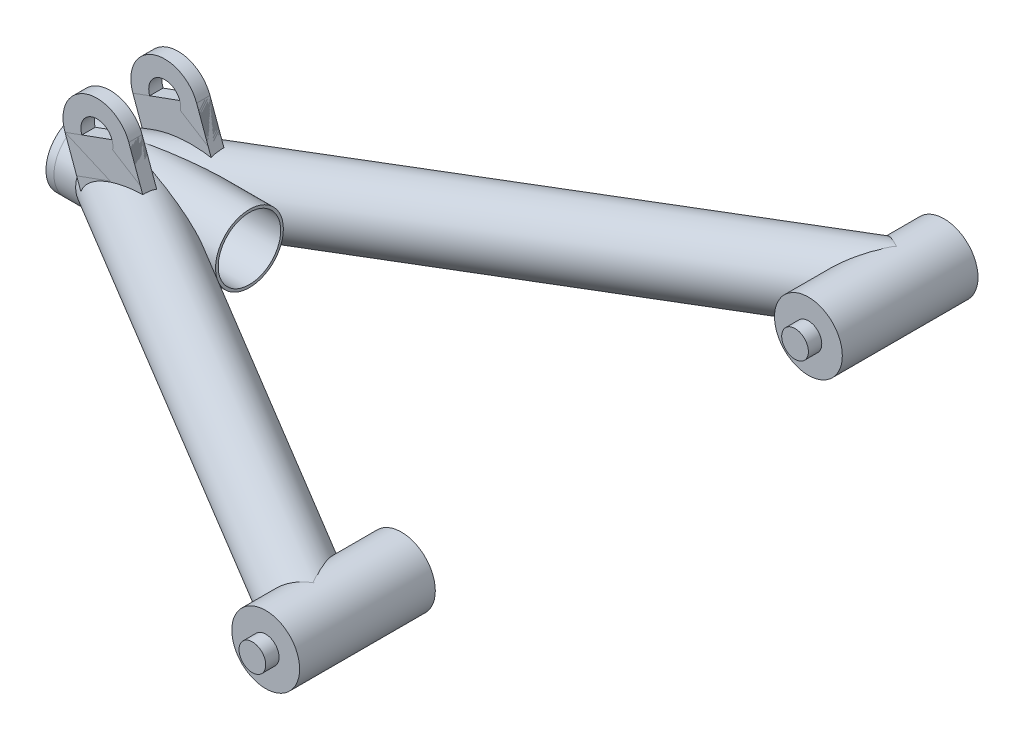
from build123d import *

# Parameters (mm, degrees)
ONEINCH_START                               = 87.83326389
ONEINCH_PIPE_ONE_INCH_1_OUTLINE_R           = 12.7
ONEINCH_PIPE_ONE_INCH_1_OUTLINE_R_2         = 11.7
ONEINCH_PIPE_ONE_INCH_1_DEPTH               = 143.870277309
ONEINCH_START_2                             = 41.95848565
ONEINCH_PIPE_ONE_INCH_1_2_OUTLINE_R         = 12.7
ONEINCH_PIPE_ONE_INCH_1_2_OUTLINE_R_2       = 11.7
ONEINCH_PIPE_ONE_INCH_1_2_DEPTH             = 212.168707844
ONEINCH_START_3                             = -3.509192285
ONEINCH_PIPE_ONE_INCH_1_3_DEPTH             = 14.401092481
ONEINCH_START_4                             = -120.003337429
ONEINCH_PIPE_ONE_INCH_1_4_DEPTH             = 116.494145144
ONEINCH_START_5                             = 42.39257022
ONEINCH_PIPE_ONE_INCH_1_5_DEPTH             = 194.510357761
ONEINCH_PIPE_ONE_INCH_1_6_OUTLINE_R         = 12.7
ONEINCH_PIPE_ONE_INCH_1_6_OUTLINE_R_2       = 11.7
ONEINCH_PIPE_ONE_INCH_1_6_DEPTH             = 143.870277309
ONEINCH_PIPE_ONE_INCH_1_7_OUTLINE_R         = 12.7
ONEINCH_PIPE_ONE_INCH_1_7_OUTLINE_R_2       = 11.7
ONEINCH_PIPE_ONE_INCH_1_7_DEPTH             = 212.168707844
ONEINCH_START_6                             = -10.891900196
ONEINCH_PIPE_ONE_INCH_1_8_DEPTH             = 14.401092481
ONEINCH_START_7                             = 3.509192285
ONEINCH_PIPE_ONE_INCH_1_9_DEPTH             = 116.494145144
ONEINCH_PIPE_ONE_INCH_1_10_DEPTH            = 194.510357761
ONEINCH_START_8                             = 37.29
ONEINCH_PIPE_ONE_INCH_1_11_OUTLINE_R        = 12.7
ONEINCH_PIPE_ONE_INCH_1_11_OUTLINE_R_2      = 11.7
ONEINCH_PIPE_ONE_INCH_1_11_DEPTH            = 60.5
ONEINCH_START_9                             = 76.2
ONEINCH_PIPE_ONE_INCH_1_12_OUTLINE_R        = 12.7
ONEINCH_PIPE_ONE_INCH_1_12_OUTLINE_R_2      = 11.7
ONEINCH_PIPE_ONE_INCH_1_12_DEPTH            = 50.8
ONEINCH_START_10                            = -127
ONEINCH_PIPE_ONE_INCH_1_13_OUTLINE_R        = 12.7
ONEINCH_PIPE_ONE_INCH_1_13_OUTLINE_R_2      = 11.7
ONEINCH_PIPE_ONE_INCH_1_13_DEPTH            = 50.8
SKETCH16_R                                  = 12.7
SKETCH16_R_2                                = 6
WASHERS_ONEINCHDIA12MM_1_DEPTH              = 3
SKETCH110_R                                 = 6
SUSPENSIONMOUNT_12MMHOLE1INCHWIDE_1_DEPTH   = 5
SKETCH110_ON_SEGMENT_2_R                    = 6
SUSPENSIONMOUNT_12MMHOLE1INCHWIDE_1_2_DEPTH = 5
SKETCH112_W                                 = 25.4
SKETCH112_H                                 = 5
ONEINCH_ONE_INCH_5MM_PLATE_3_DEPTH          = 24.072735663
SKETCH112_ON_SEGMENT_2_W                    = 25.4
SKETCH112_ON_SEGMENT_2_H                    = 5
ONEINCH_ONE_INCH_5MM_PLATE_3_2_DEPTH        = 21.307396636
SKETCH114_R                                 = 12.7
SKETCH114_R_2                               = 5
SUSPENSIONMOUNT_BUSHING10MM_1_DEPTH         = 50.8
SKETCH114_ON_SEGMENT_2_R                    = 12.7
SKETCH114_ON_SEGMENT_2_R_2                  = 5
SUSPENSIONMOUNT_BUSHING10MM_1_2_DEPTH       = 50.8
BOSS_EXTRUDE1_DEPTH                         = 5
BOSS_EXTRUDE1_DEPTH_BACK                    = 55.8
SKETCH115_R                                 = 5
BOSS_EXTRUDE2_DEPTH                         = 5
BOSS_EXTRUDE2_DEPTH_BACK                    = 55.8
SKETCH116_R                                 = 5


with BuildPart() as part:
    # Oneinch PIPE_ONE_INCH(1): read off the stored shape, not the designer's step
    # Oneinch PIPE_ONE_INCH(1) outline → Oneinch PIPE_ONE_INCH(1) (new body)
    with BuildSketch(Plane(origin=(0, 0, 0), x_dir=(0.5142673415114335, 0, 0.8576299326951937), z_dir=(0.8576299326951937, 0, -0.5142673415114338)).offset(ONEINCH_START)):
        with Locations((25.159894842, 0)):
            Circle(ONEINCH_PIPE_ONE_INCH_1_OUTLINE_R)
        with Locations((25.159894842, 0)):
            Circle(ONEINCH_PIPE_ONE_INCH_1_OUTLINE_R_2, mode=Mode.SUBTRACT)
    extrude(amount=ONEINCH_PIPE_ONE_INCH_1_DEPTH)

    # Oneinch PIPE_ONE_INCH_1 2 outline → Oneinch PIPE_ONE_INCH_1 2 (add)
    with BuildSketch(Plane(origin=(0, 0, 0), x_dir=(0.5142673415114335, 0, 0.8576299326951937), z_dir=(0.8576299326951937, 0, -0.5142673415114338)).offset(ONEINCH_START_2)):
        with Locations((25.159894842, 0)):
            Circle(ONEINCH_PIPE_ONE_INCH_1_2_OUTLINE_R)
        with Locations((25.159894842, 0)):
            Circle(ONEINCH_PIPE_ONE_INCH_1_2_OUTLINE_R_2, mode=Mode.SUBTRACT)
    extrude(amount=ONEINCH_PIPE_ONE_INCH_1_2_DEPTH)

    # Oneinch PIPE_ONE_INCH_1 3 outline → Oneinch PIPE_ONE_INCH_1 3 (cut)
    with BuildSketch(Plane.XY.offset(ONEINCH_START_3)):
        with BuildLine():
            Line((239, -12.7), (230.886, -12.7))
            ThreePointArc((230.886, -12.7), (218.186, 0), (230.886, 12.7))
            Line((230.886, 12.7), (239, 12.7))
            Line((239, 12.7), (239, 14))
            Line((239, 14), (71, 14))
            Line((71, 14), (71, -14))
            Line((71, -14), (239, -14))
            Line((239, -14), (239, -12.7))
        make_face()
    extrude(amount=ONEINCH_PIPE_ONE_INCH_1_3_DEPTH, mode=Mode.SUBTRACT)

    # Oneinch PIPE_ONE_INCH_1 4 outline → Oneinch PIPE_ONE_INCH_1 4 (cut)
    with BuildSketch(Plane.XY.offset(ONEINCH_START_4)):
        with BuildLine():
            ThreePointArc((230.886, 12.7), (218.186, 0), (230.886, -12.7))
            Line((230.886, -12.7), (239, -12.7))
            Line((239, -12.7), (239, 12.7))
            Line((239, 12.7), (230.886, 12.7))
        make_face()
    extrude(amount=ONEINCH_PIPE_ONE_INCH_1_4_DEPTH, mode=Mode.SUBTRACT)

    # Oneinch PIPE_ONE_INCH_1 5 outline → Oneinch PIPE_ONE_INCH_1 5 (cut)
    with BuildSketch(Plane.YZ.offset(ONEINCH_START_5)):
        with BuildLine():
            ThreePointArc((-12.7, 0), (0, -12.7), (12.7, 0))
            Line((12.7, 0), (12.7, 12))
            Line((12.7, 12), (-12.7, 12))
            Line((-12.7, 12), (-12.7, 0))
        make_face()
    extrude(amount=ONEINCH_PIPE_ONE_INCH_1_5_DEPTH, mode=Mode.SUBTRACT)


with BuildPart() as body_2:
    # Oneinch PIPE_ONE_INCH_1 6 outline → Oneinch PIPE_ONE_INCH_1 6 (new body)
    with BuildSketch(Plane(origin=(0, 0, 0), x_dir=(0.5142673415114335, 0, -0.8576299326951937), z_dir=(0.8576299326951937, 0, 0.5142673415114338)).offset(ONEINCH_START)):
        with Locations((25.159894842, 0)):
            Circle(ONEINCH_PIPE_ONE_INCH_1_6_OUTLINE_R)
        with Locations((25.159894842, 0)):
            Circle(ONEINCH_PIPE_ONE_INCH_1_6_OUTLINE_R_2, mode=Mode.SUBTRACT)
    extrude(amount=ONEINCH_PIPE_ONE_INCH_1_6_DEPTH)

    # Oneinch PIPE_ONE_INCH_1 7 outline → Oneinch PIPE_ONE_INCH_1 7 (add)
    with BuildSketch(Plane(origin=(0, 0, 0), x_dir=(0.5142673415114335, 0, -0.8576299326951937), z_dir=(0.8576299326951937, 0, 0.5142673415114338)).offset(ONEINCH_START_2)):
        with Locations((25.159894842, 0)):
            Circle(ONEINCH_PIPE_ONE_INCH_1_7_OUTLINE_R)
        with Locations((25.159894842, 0)):
            Circle(ONEINCH_PIPE_ONE_INCH_1_7_OUTLINE_R_2, mode=Mode.SUBTRACT)
    extrude(amount=ONEINCH_PIPE_ONE_INCH_1_7_DEPTH)

    # Oneinch PIPE_ONE_INCH_1 8 outline → Oneinch PIPE_ONE_INCH_1 8 (cut)
    with BuildSketch(Plane.XY.offset(ONEINCH_START_6)):
        with BuildLine():
            Line((239, -12.7), (230.886, -12.7))
            ThreePointArc((230.886, -12.7), (218.186, 0), (230.886, 12.7))
            Line((230.886, 12.7), (239, 12.7))
            Line((239, 12.7), (239, 14))
            Line((239, 14), (71, 14))
            Line((71, 14), (71, -14))
            Line((71, -14), (239, -14))
            Line((239, -14), (239, -12.7))
        make_face()
    extrude(amount=ONEINCH_PIPE_ONE_INCH_1_8_DEPTH, mode=Mode.SUBTRACT)

    # Oneinch PIPE_ONE_INCH_1 9 outline → Oneinch PIPE_ONE_INCH_1 9 (cut)
    with BuildSketch(Plane.XY.offset(ONEINCH_START_7)):
        with BuildLine():
            ThreePointArc((230.886, 12.7), (218.186, 0), (230.886, -12.7))
            Line((230.886, -12.7), (239, -12.7))
            Line((239, -12.7), (239, 12.7))
            Line((239, 12.7), (230.886, 12.7))
        make_face()
    extrude(amount=ONEINCH_PIPE_ONE_INCH_1_9_DEPTH, mode=Mode.SUBTRACT)

    # Oneinch PIPE_ONE_INCH_1 10 outline → Oneinch PIPE_ONE_INCH_1 10 (cut)
    with BuildSketch(Plane.YZ.offset(ONEINCH_START_5)):
        with BuildLine():
            ThreePointArc((12.7, 0), (0, 12.7), (-12.7, 0))
            Line((-12.7, 0), (-12.7, -12))
            Line((-12.7, -12), (12.7, -12))
            Line((12.7, -12), (12.7, 0))
        make_face()
    extrude(amount=ONEINCH_PIPE_ONE_INCH_1_10_DEPTH, mode=Mode.SUBTRACT)


with BuildPart() as body_3:
    # Oneinch PIPE_ONE_INCH_1 11 outline → Oneinch PIPE_ONE_INCH_1 11 (new body)
    with BuildSketch(Plane.YZ.offset(ONEINCH_START_8)):
        Circle(ONEINCH_PIPE_ONE_INCH_1_11_OUTLINE_R)
        Circle(ONEINCH_PIPE_ONE_INCH_1_11_OUTLINE_R_2, mode=Mode.SUBTRACT)
    extrude(amount=ONEINCH_PIPE_ONE_INCH_1_11_DEPTH)


with BuildPart() as body_4:
    # Oneinch PIPE_ONE_INCH_1 12 outline → Oneinch PIPE_ONE_INCH_1 12 (new body)
    with BuildSketch(Plane.XY.offset(ONEINCH_START_9)):
        with Locations((230.886, 0)):
            Circle(ONEINCH_PIPE_ONE_INCH_1_12_OUTLINE_R)
        with Locations((230.886, 0)):
            Circle(ONEINCH_PIPE_ONE_INCH_1_12_OUTLINE_R_2, mode=Mode.SUBTRACT)
    extrude(amount=ONEINCH_PIPE_ONE_INCH_1_12_DEPTH)


with BuildPart() as body_5:
    # Oneinch PIPE_ONE_INCH_1 13 outline → Oneinch PIPE_ONE_INCH_1 13 (new body)
    with BuildSketch(Plane.XY.offset(ONEINCH_START_10)):
        with Locations((230.886, 0)):
            Circle(ONEINCH_PIPE_ONE_INCH_1_13_OUTLINE_R)
        with Locations((230.886, 0)):
            Circle(ONEINCH_PIPE_ONE_INCH_1_13_OUTLINE_R_2, mode=Mode.SUBTRACT)
    extrude(amount=ONEINCH_PIPE_ONE_INCH_1_13_DEPTH)


with BuildPart() as body_6:
    # Sketch16 → Washers ONEINCHDIA12MM(1) (new body)
    with BuildSketch(Plane(origin=(34.29, 0, 0), x_dir=(0, 0, -1), z_dir=(1, 0, 0))):
        Circle(SKETCH16_R)
        Circle(SKETCH16_R_2, mode=Mode.SUBTRACT)
    extrude(amount=WASHERS_ONEINCHDIA12MM_1_DEPTH)


with BuildPart() as body_7:
    # Sketch110 → Suspensionmount 12MMHOLE1INCHWIDE(1) (new body)
    with BuildSketch(Plane(origin=(55.88, 22.7, -10.2), x_dir=(-0.3420201433256569, 0.9396926207859126, 0), z_dir=(0, 0, -1))):
        with BuildLine():
            Line((-12.7, 12.7), (-12.7, -12.7))
            Line((-12.7, -12.7), (0, -12.7))
            ThreePointArc((0, -12.7), (12.7, 0), (0, 12.7))
            Line((0, 12.7), (-12.7, 12.7))
        make_face()
        Circle(SKETCH110_R, mode=Mode.SUBTRACT)
    extrude(amount=SUSPENSIONMOUNT_12MMHOLE1INCHWIDE_1_DEPTH)


with BuildPart() as body_8:
    # Sketch110 on segment 2 (carried to segment 2) → Suspensionmount 12MMHOLE1INCHWIDE_1 2 (new body)
    with BuildSketch(Plane(origin=(55.88, 22.7, 15.2), x_dir=(-0.342020143, 0.939692621, 0), z_dir=(0, 0, -1))):
        with BuildLine():
            Line((-12.7, 12.7), (-12.7, -12.7))
            Line((-12.7, -12.7), (0, -12.7))
            ThreePointArc((0, -12.7), (12.7, 0), (0, 12.7))
            Line((0, 12.7), (-12.7, 12.7))
        make_face()
        Circle(SKETCH110_ON_SEGMENT_2_R, mode=Mode.SUBTRACT)
    extrude(amount=SUSPENSIONMOUNT_12MMHOLE1INCHWIDE_1_2_DEPTH)


with BuildPart() as body_9:
    # Sketch112 → Oneinch ONE_INCH_5MM_PLATE(3) (new body)
    with BuildSketch(Plane(origin=(55.88, 22.7, 12.7), x_dir=(0.9396926207859104, 0.3420201433256633, 8.521585158946994e-14), z_dir=(0.3420201433256633, -0.9396926207859104, -2.3412862802166917e-13))):
        Rectangle(SKETCH112_W, SKETCH112_H)
    extrude(amount=ONEINCH_ONE_INCH_5MM_PLATE_3_DEPTH)


with BuildPart() as body_10:
    # Sketch112 on segment 2 (carried to segment 2) → Oneinch ONE_INCH_5MM_PLATE_3 2 (new body)
    with BuildSketch(Plane(origin=(55.88, 22.7, -12.7), x_dir=(0.939692621, 0.342020143, 0), z_dir=(0.342020143, -0.939692621, 0))):
        Rectangle(SKETCH112_ON_SEGMENT_2_W, SKETCH112_ON_SEGMENT_2_H)
    extrude(amount=ONEINCH_ONE_INCH_5MM_PLATE_3_2_DEPTH)


with BuildPart() as body_9_2:
    # Sketch114 → Suspensionmount BUSHING10MM(1) (new body)
    with BuildSketch(Plane(origin=(230.886, 0, -127), x_dir=(1, 0, 0), z_dir=(0, 0, 1))):
        Circle(SKETCH114_R)
        Circle(SKETCH114_R_2, mode=Mode.SUBTRACT)
    extrude(amount=SUSPENSIONMOUNT_BUSHING10MM_1_DEPTH)


with BuildPart() as body_10_2:
    # Sketch114 on segment 2 (carried to segment 2) → Suspensionmount BUSHING10MM_1 2 (new body)
    with BuildSketch(Plane(origin=(230.886, 0, 76.2), x_dir=(1, 0, 0), z_dir=(0, 0, 1))):
        Circle(SKETCH114_ON_SEGMENT_2_R)
        Circle(SKETCH114_ON_SEGMENT_2_R_2, mode=Mode.SUBTRACT)
    extrude(amount=SUSPENSIONMOUNT_BUSHING10MM_1_2_DEPTH)


with BuildPart() as body_11:
    # Sketch115 → Boss-Extrude1 (new, two sides: drawn at the far end of the back side and taken through both)
    with BuildSketch(Plane.XY.offset(-76.2).offset(-BOSS_EXTRUDE1_DEPTH_BACK)):
        with Locations((230.886, 0)):
            Circle(SKETCH115_R)
    extrude(amount=BOSS_EXTRUDE1_DEPTH + BOSS_EXTRUDE1_DEPTH_BACK)


with BuildPart() as body_12:
    # Sketch116 → Boss-Extrude2 (new, two sides: drawn at the far end of the back side and taken through both)
    with BuildSketch(Plane.XY.offset(127).offset(-BOSS_EXTRUDE2_DEPTH_BACK)):
        with Locations((230.886, 0)):
            Circle(SKETCH116_R)
    extrude(amount=BOSS_EXTRUDE2_DEPTH + BOSS_EXTRUDE2_DEPTH_BACK)


solid = Compound([part.part, body_2.part, body_3.part, body_6.part, body_7.part, body_8.part, body_9.part, body_10.part, body_9_2.part, body_10_2.part, body_11.part, body_12.part])
